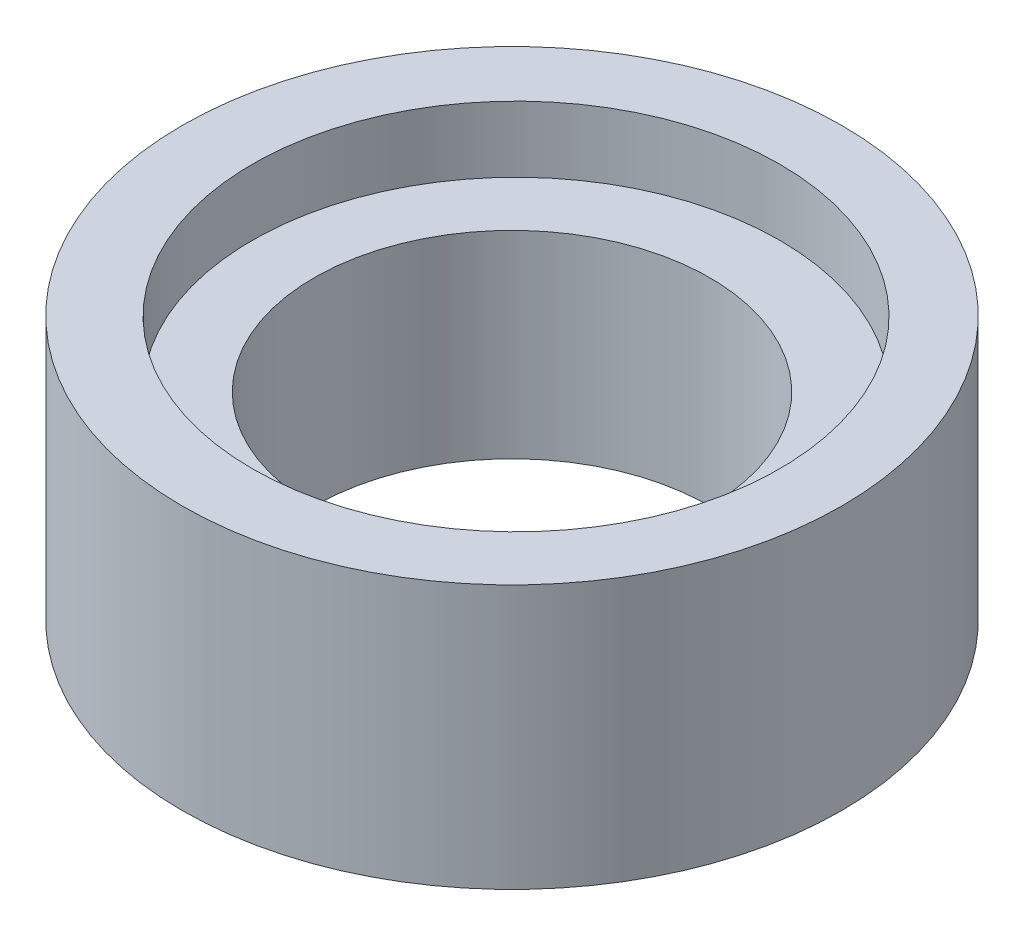
from build123d import *

# Parameters (mm, degrees)
SKETCH1_R               = 25
BOSS_EXTRUDE5_DEPTH     = 20
CUT_EXTRUDE2_DEPTH      = 1
CUT_EXTRUDE2_DEPTH_BACK = 5
SKETCH5_R               = 20
SKETCH9_R               = 15
CUT_EXTRUDE3_DEPTH      = 29


with BuildPart() as part:
    # Sketch1 → Boss-Extrude5 (new body)
    with BuildSketch(Plane(origin=(0, 0, 0), x_dir=(1, 0, 0), z_dir=(0, 1, 0))):
        Circle(SKETCH1_R)
    extrude(amount=BOSS_EXTRUDE5_DEPTH)

    # Sketch5 → Cut-Extrude2 (cut, two sides: drawn at the far end of the back side and taken through both)
    with BuildSketch(Plane(origin=(0, 20, 0), x_dir=(1, 0, 0), z_dir=(0, 1, 0)).offset(-CUT_EXTRUDE2_DEPTH_BACK)):
        with Locations((0.202413874, 0.104402365)):
            Circle(SKETCH5_R)
    extrude(amount=CUT_EXTRUDE2_DEPTH + CUT_EXTRUDE2_DEPTH_BACK, mode=Mode.SUBTRACT)

    # Sketch9 → Cut-Extrude3 (cut)
    with BuildSketch(Plane(origin=(0, 15, 0), x_dir=(1, 0, 0), z_dir=(0, 1, 0))):
        Circle(SKETCH9_R)
    extrude(amount=-CUT_EXTRUDE3_DEPTH, mode=Mode.SUBTRACT)


solid = part.part
